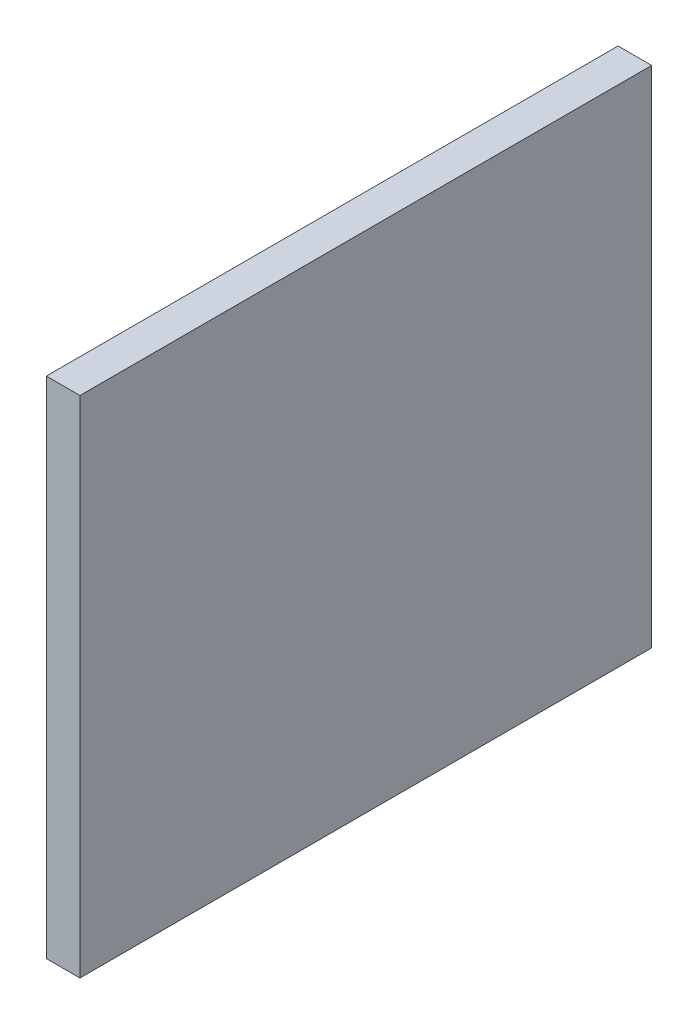
from build123d import *

# Parameters (mm, degrees)
SKETCH1_W           = 10
SKETCH1_H           = 150
BOSS_EXTRUDE1_DEPTH = 170


with BuildPart() as part:
    # Sketch1 → Boss-Extrude1 (new body)
    with BuildSketch(Plane.XY):
        with Locations((155, -75)):
            Rectangle(SKETCH1_W, SKETCH1_H)
    extrude(amount=BOSS_EXTRUDE1_DEPTH)


solid = part.part
